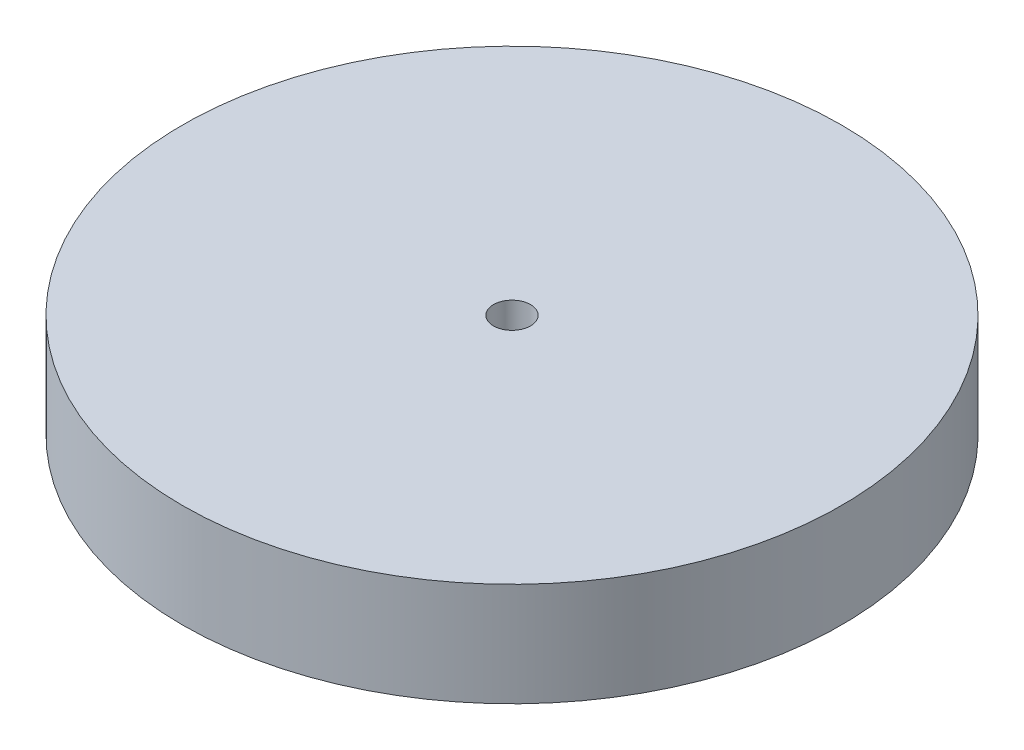
from build123d import *

# Parameters (mm, degrees)
SKETCH1_R           = 60.5
BOSS_EXTRUDE1_DEPTH = 19
SKETCH2_R           = 3.4
CUT_EXTRUDE2_DEPTH  = 88.644166948


with BuildPart() as part:
    # Sketch1 → Boss-Extrude1 (new body)
    with BuildSketch(Plane(origin=(0, 0, 0), x_dir=(1, 0, 0), z_dir=(0, 1, 0))):
        Circle(SKETCH1_R)
    extrude(amount=BOSS_EXTRUDE1_DEPTH)

    # Sketch2 → Cut-Extrude2 (cut, through all)
    with BuildSketch(Plane(origin=(0, 19, 0), x_dir=(1, 0, 0), z_dir=(0, 1, 0))):
        Circle(SKETCH2_R)
    extrude(amount=-CUT_EXTRUDE2_DEPTH, mode=Mode.SUBTRACT)


solid = part.part
